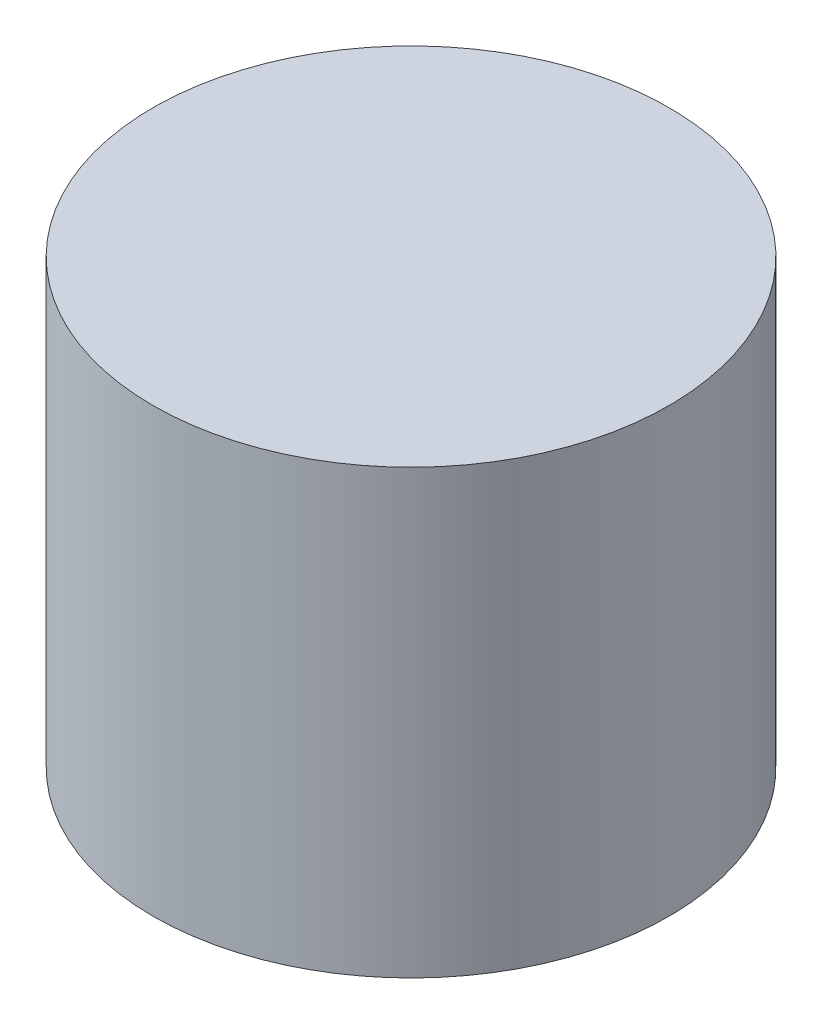
from build123d import *

# Parameters (mm, degrees)
SKETCH1_R           = 7
BOSS_EXTRUDE1_DEPTH = 12
CUT_EXTRUDE1_DEPTH  = 5


with BuildPart() as part:
    # Sketch1 → Boss-Extrude1 (new body)
    with BuildSketch(Plane(origin=(0, 0, 0), x_dir=(1, 0, 0), z_dir=(0, 1, 0))):
        Circle(SKETCH1_R)
    extrude(amount=BOSS_EXTRUDE1_DEPTH)

    # Sketch2 → Cut-Extrude1 (cut)
    with BuildSketch(Plane.XZ):
        with BuildLine():
            Line((-2.75, -1), (2.75, -1))
            ThreePointArc((2.75, -1), (0, 2.926174978), (-2.75, -1))
        make_face()
    extrude(amount=-CUT_EXTRUDE1_DEPTH, mode=Mode.SUBTRACT)


solid = part.part
